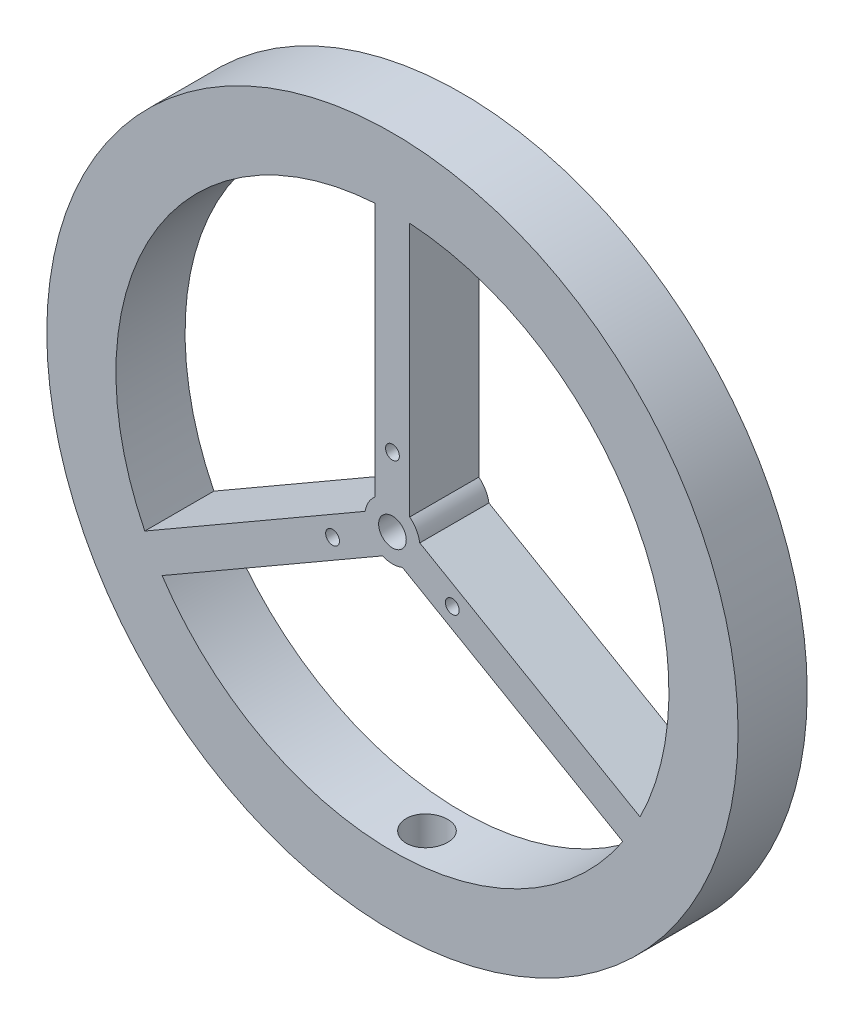
from build123d import *

# Parameters (mm, degrees)
SKETCH2_R           = 50
BOSS_EXTRUDE1_DEPTH = 10
SKETCH1_R           = 1
SKETCH1_R_2         = 2
CUT_EXTRUDE2_DEPTH  = 72.414284285
CUT_EXTRUDE3_START  = -10
SKETCH3_R           = 3
CUT_EXTRUDE3_DEPTH  = 62.414284285


with BuildPart() as part:
    # Sketch2 → Boss-Extrude1 (new body)
    with BuildSketch(Plane.XY):
        Circle(SKETCH2_R)
        with BuildLine():
            Line((2.5, 39.921798557), (2.5, 3.122498999))
            ThreePointArc((2.5, 3.122498999), (3.464101615, 2), (3.954163457, 0.60381401))
            Line((3.954163457, 0.60381401), (35.823291715, -17.795835769))
            ThreePointArc((35.823291715, -17.795835769), (34.641016151, 20), (2.5, 39.921798557))
        make_face(mode=Mode.SUBTRACT)
        with BuildLine():
            Line((-2.5, 39.921798557), (-2.5, 3.122498999))
            ThreePointArc((-2.5, 3.122498999), (-3.464101615, 2), (-3.954163457, 0.60381401))
            Line((-3.954163457, 0.60381401), (-35.823291715, -17.795835769))
            ThreePointArc((-35.823291715, -17.795835769), (-34.641016151, 20), (-2.5, 39.921798557))
        make_face(mode=Mode.SUBTRACT)
        with BuildLine():
            Line((33.323291715, -22.125962788), (1.454163457, -3.726313009))
            ThreePointArc((1.454163457, -3.726313009), (0, -4), (-1.454163457, -3.726313009))
            Line((-1.454163457, -3.726313009), (-33.323291715, -22.125962788))
            ThreePointArc((-33.323291715, -22.125962788), (0, -40), (33.323291715, -22.125962788))
        make_face(mode=Mode.SUBTRACT)
    extrude(amount=BOSS_EXTRUDE1_DEPTH)

    # Sketch1 → Cut-Extrude2 (cut, through all)
    with BuildSketch(Plane.XY):
        with Locations((0, 10)):
            Circle(SKETCH1_R)
        Circle(SKETCH1_R_2)
        with Locations((-8.660254038, -5)):
            Circle(SKETCH1_R)
        with Locations((8.660254038, -5)):
            Circle(SKETCH1_R)
    extrude(amount=CUT_EXTRUDE2_DEPTH, mode=Mode.SUBTRACT)

    # Sketch3 → Cut-Extrude3 (cut, through all)
    with BuildSketch(Plane(origin=(0, 0, 0), x_dir=(1, 0, 0), z_dir=(0, 1, 0)).offset(CUT_EXTRUDE3_START)):
        with Locations((0, -5)):
            Circle(SKETCH3_R)
    extrude(amount=-CUT_EXTRUDE3_DEPTH, mode=Mode.SUBTRACT)


solid = part.part
